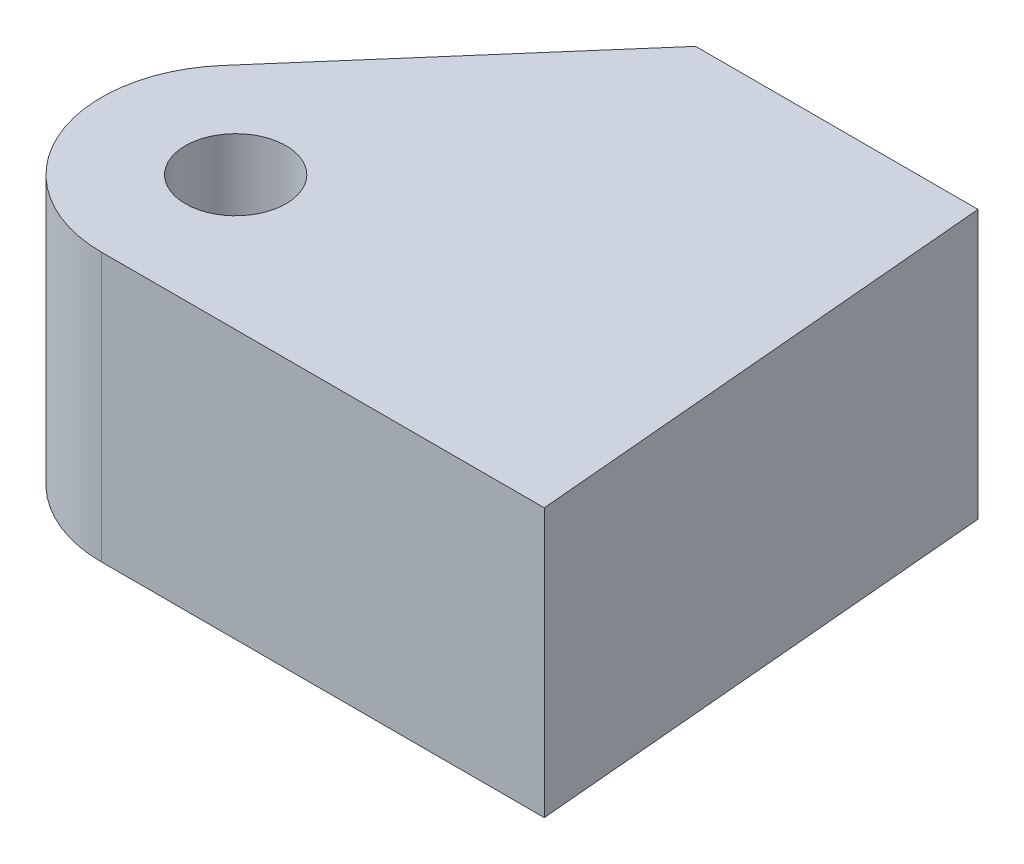
from build123d import *

# Parameters (mm, degrees)
SKETCH1_R           = 1.5
BOSS_EXTRUDE1_DEPTH = 8


with BuildPart() as part:
    # Sketch1 → Boss-Extrude1 (new body)
    with BuildSketch(Plane(origin=(0, 0, 0), x_dir=(1, 0, 0), z_dir=(0, 1, 0))):
        with BuildLine():
            Line((7.541751969, 14.171331918), (0.981161679, 6.624236116))
            ThreePointArc((0.981161679, 6.624236116), (0.360154916, 2.341227029), (4, 0))
            Line((4, 0), (17.2, 0))
            Line((17.2, 0), (15.96016911, 14.171331918))
            Line((15.96016911, 14.171331918), (7.541751969, 14.171331918))
        make_face()
        with Locations((4, 4)):
            Circle(SKETCH1_R, mode=Mode.SUBTRACT)
    extrude(amount=BOSS_EXTRUDE1_DEPTH)


solid = part.part
